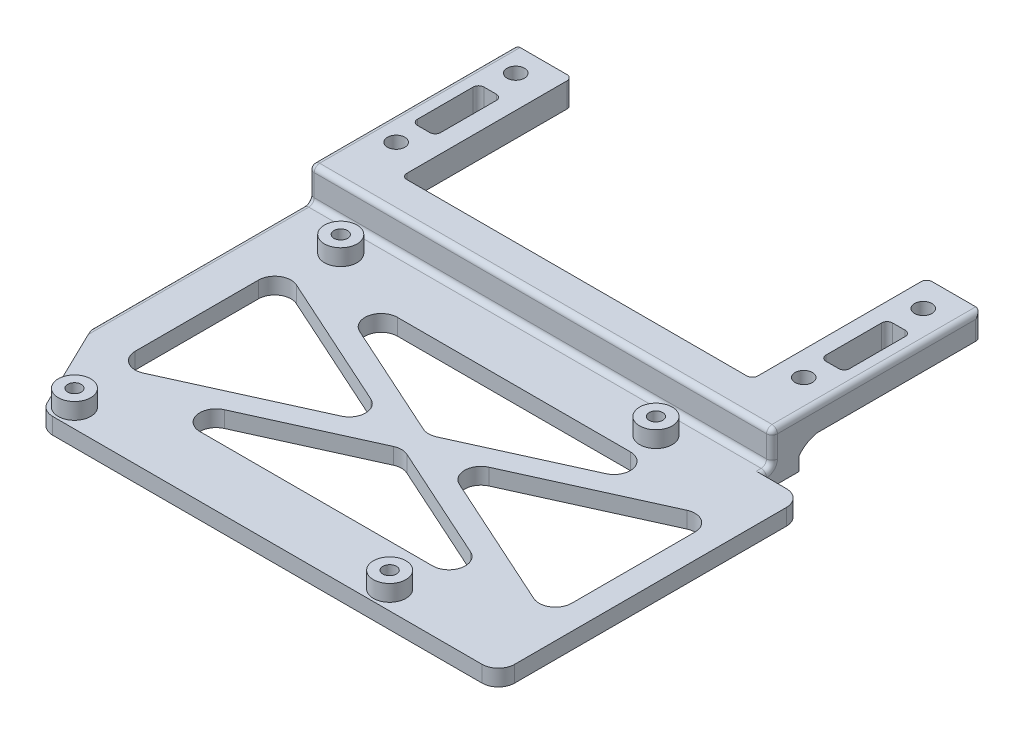
from build123d import *

# Parameters (mm, degrees)
SKETCH1_R           = 1.25
SKETCH1_R_2         = 1.6
BOSS_EXTRUDE1_DEPTH = 3
SKETCH2_W           = 13.728592923
SKETCH2_H           = 41.891364037
CUT_EXTRUDE1_DEPTH  = 3
SKETCH3_W           = 10.623930571
SKETCH3_H           = 41.891364037
SKETCH3_R           = 1.6
SKETCH3_W_2         = 10.036107103
SKETCH3_H_2         = 42.491364037
BOSS_EXTRUDE2_DEPTH = 6
SKETCH4_W           = 41.491364037
SKETCH4_H           = 4.5
CUT_EXTRUDE2_DEPTH  = 115
SKETCH6_W           = 64.582782425
SKETCH6_H           = 2.414533823
BOSS_EXTRUDE3_DEPTH = 4.5
SKETCH7_W           = 80.326682628
SKETCH7_H           = 36.376260707
CUT_EXTRUDE3_DEPTH  = 115
EXTRUDE_THIN1_DEPTH = 3
FILLET2_R           = 3
FILLET3_R           = 1
SKETCH10_R          = 3
SKETCH10_R_2        = 1.25
BOSS_EXTRUDE4_DEPTH = 3
FILLET4_R           = 5
SKETCH13_W          = 85.242820099
SKETCH13_H          = 8
CUT_EXTRUDE5_DEPTH  = 12
SKETCH14_W          = 4.268681069
SKETCH14_H          = 12.243871332
SKETCH14_W_2        = 4.340282215
CUT_EXTRUDE6_DEPTH  = 12
FILLET5_R           = 1
FILLET6_R           = 1


with BuildPart() as part:
    # Sketch1 → Boss-Extrude1 (new body)
    # profile 1 of 4: a face of its own
    with BuildSketch(Plane(origin=(0, 0, 0), x_dir=(1, 0, 0), z_dir=(0, 1, 0))):
        with BuildLine():
            Line((-3.5, 0.5), (-3.5, -34.098087325))
            Line((-3.5, -34.098087325), (73.95, -34.098087325))
            Line((73.95, -34.098087325), (73.95, 3.5))
            Line((73.95, 3.5), (-0.5, 3.5))
            ThreePointArc((-0.5, 3.5), (-2.621320344, 2.621320344), (-3.5, 0.5))
        make_face()
        with Locations(Location((0, 0, 0), (0, 0, 270))):
            Circle(SKETCH1_R, mode=Mode.SUBTRACT)
        with Locations(Location((58, 0, 0), (0, 0, 270))):
            Circle(SKETCH1_R, mode=Mode.SUBTRACT)
    # profile 2 of 4: a face of its own
    with BuildSketch(Plane(origin=(0, 0, 0), x_dir=(1, 0, 0), z_dir=(0, 1, 0))):
        with BuildLine():
            Line((73.95, -34.098087325), (-3.5, -34.098087325))
            Line((-3.5, -34.098087325), (-3.5, -49.5))
            ThreePointArc((-3.5, -49.5), (-3.424038303, -50.170820393), (-3.2, -50.807669683))
            ThreePointArc((-3.2, -50.807669683), (-2.093265664, -52.041948962), (-0.5, -52.5))
            Line((-0.5, -52.5), (78.5, -52.5))
            ThreePointArc((78.5, -52.5), (80.621320344, -51.621320344), (81.5, -49.5))
            Line((81.5, -49.5), (81.5, 0.5))
            ThreePointArc((81.5, 0.5), (80.621320344, 2.621320344), (78.5, 3.5))
            Line((78.5, 3.5), (73.95, 3.5))
            Line((73.95, 3.5), (73.95, -34.098087325))
        make_face()
        with Locations(Location((0, -49, 0), (0, 0, 270))):
            Circle(SKETCH1_R, mode=Mode.SUBTRACT)
        with Locations(Location((58, -49, 0), (0, 0, 270))):
            Circle(SKETCH1_R, mode=Mode.SUBTRACT)
    # profile 3 of 4: a face of its own
    with BuildSketch(Plane(origin=(0, 0, 0), x_dir=(1, 0, 0), z_dir=(0, 1, 0))):
        with BuildLine():
            Line((-3.5, -34.098087325), (-11.292820099, -34.098087325))
            Line((-11.292820099, -34.098087325), (-3.2, -50.807669683))
            ThreePointArc((-3.2, -50.807669683), (-3.424038303, -50.170820393), (-3.5, -49.5))
            Line((-3.5, -49.5), (-3.5, -34.098087325))
        make_face()
    # profile 4 of 4: a face of its own
    with BuildSketch(Plane(origin=(0, 0, 0), x_dir=(1, 0, 0), z_dir=(0, 1, 0))):
        with BuildLine():
            Line((-11.292820099, 51.3), (-11.292820099, -34.098087325))
            Line((-11.292820099, -34.098087325), (-3.5, -34.098087325))
            Line((-3.5, -34.098087325), (-3.5, 0.5))
            ThreePointArc((-3.5, 0.5), (-2.621320344, 2.621320344), (-0.5, 3.5))
            Line((-0.5, 3.5), (73.95, 3.5))
            Line((73.95, 3.5), (73.95, 51.9))
            Line((73.95, 51.9), (63.913892897, 51.9))
            Line((63.913892897, 51.9), (63.913892897, 9.408635963))
            Line((63.913892897, 9.408635963), (13.059703395, 9.408635963))
            Line((13.059703395, 9.408635963), (13.059703395, 51.3))
            Line((13.059703395, 51.3), (-11.292820099, 51.3))
        make_face()
        with Locations(Location((-6.599999997, 24.800000181, 0), (0, 0, 270))):
            Circle(SKETCH1_R_2, mode=Mode.SUBTRACT)
        with Locations(Location((-6.599999997, 46.8, 0), (0, 0, 270))):
            Circle(SKETCH1_R_2, mode=Mode.SUBTRACT)
        with Locations(Location((68.4, 24.800000181, 0), (0, 0, 270))):
            Circle(SKETCH1_R_2, mode=Mode.SUBTRACT)
        with Locations(Location((68.4, 46.8, 0), (0, 0, 270))):
            Circle(SKETCH1_R_2, mode=Mode.SUBTRACT)
    extrude(amount=BOSS_EXTRUDE1_DEPTH)

    # Sketch2 → Cut-Extrude1 (cut)
    with BuildSketch(Plane(origin=(0, 3, 0), x_dir=(1, 0, 0), z_dir=(0, 1, 0))):
        with Locations((6.195406934, 30.354317982)):
            Rectangle(SKETCH2_W, SKETCH2_H)
    extrude(amount=-CUT_EXTRUDE1_DEPTH, mode=Mode.SUBTRACT)

    # Sketch3 → Boss-Extrude2 (add)
    # profile 1 of 3: a face of its own
    with BuildSketch(Plane(origin=(0, 3, 0), x_dir=(1, 0, 0), z_dir=(0, 1, 0))):
        Polygon((-11.292820099, 9.408635963), (-11.292820099, 5.408635963), (73.95, 5.408635963), (73.95, 9.408635963), (63.913892897, 9.408635963), (-0.668889528, 9.408635963), align=None)
    # profile 2 of 3: a face of its own
    with BuildSketch(Plane(origin=(0, 3, 0), x_dir=(1, 0, 0), z_dir=(0, 1, 0))):
        with Locations((-5.980854813, 30.354317982)):
            Rectangle(SKETCH3_W, SKETCH3_H)
        with Locations(Location((-6.599999997, 24.800000181, 0), (0, 0, 270))):
            Circle(SKETCH3_R, mode=Mode.SUBTRACT)
        with Locations(Location((-6.599999997, 46.8, 0), (0, 0, 270))):
            Circle(SKETCH3_R, mode=Mode.SUBTRACT)
    # profile 3 of 3: a face of its own
    with BuildSketch(Plane(origin=(0, 3, 0), x_dir=(1, 0, 0), z_dir=(0, 1, 0))):
        with Locations((68.931946448, 30.654317982)):
            Rectangle(SKETCH3_W_2, SKETCH3_H_2)
        with Locations(Location((68.4, 24.800000181, 0), (0, 0, 270))):
            Circle(SKETCH3_R, mode=Mode.SUBTRACT)
        with Locations(Location((68.4, 46.8, 0), (0, 0, 270))):
            Circle(SKETCH3_R, mode=Mode.SUBTRACT)
    extrude(amount=BOSS_EXTRUDE2_DEPTH)

    # Sketch4 → Cut-Extrude2 (cut)
    with BuildSketch(Plane(origin=(73.95, 0, 0), x_dir=(0, 0, -1), z_dir=(1, 0, 0))):
        with Locations((31.154317982, 2.25)):
            Rectangle(SKETCH4_W, SKETCH4_H)
    extrude(amount=-CUT_EXTRUDE2_DEPTH, mode=Mode.SUBTRACT)

    # Sketch6 → Boss-Extrude3 (add)
    with BuildSketch(Plane(origin=(0, 9, 0), x_dir=(1, 0, 0), z_dir=(0, 1, 0))):
        with Locations((31.622501685, 10.615902875)):
            Rectangle(SKETCH6_W, SKETCH6_H)
    extrude(amount=-BOSS_EXTRUDE3_DEPTH)

    # Sketch7 → Cut-Extrude3 (cut)
    with BuildSketch(Plane(origin=(0, 3, 0), x_dir=(1, 0, 0), z_dir=(0, 1, 0))):
        with Locations((36.856097488, -23.178739559)):
            Rectangle(SKETCH7_W, SKETCH7_H)
    extrude(amount=-CUT_EXTRUDE3_DEPTH, mode=Mode.SUBTRACT)

    # Sketch9 → Extrude-Thin1 (add)
    with BuildSketch(Plane(origin=(0, 3, 0), x_dir=(1, 0, 0), z_dir=(0, 1, 0))):
        Polygon((-4.132294954, -6.812501253), (76.194387674, -43.188761961), (77.844489931, -39.544977864), (-2.482192698, -3.168717156), align=None)
        Polygon((76.194387674, -3.168717156), (-4.132294954, -39.544977864), (-2.482192698, -43.188761961), (77.844489931, -6.812501253), align=None)
    extrude(amount=-EXTRUDE_THIN1_DEPTH)

    # Fillet2
    fillet2_edges = [part.edges().sort_by_distance(p)[0] for p in [
        (1.540940563, 1.5, 41.366869912),
        (72.171254414, 1.5, 41.366869912),
        (77.019438802, 1.5, 7.186128969),
        (77.019438802, 1.5, 39.171350148),
        (72.171254414, 1.5, 4.990609205),
        (1.540940563, 1.5, 4.990609205),
        (-3.307243826, 1.5, 39.171350148),
        (-3.307243826, 1.5, 7.186128969),
        (32.007913099, 1.5, 23.178739558),
        (36.856097488, 1.5, 20.983219794),
        (41.704281877, 1.5, 23.178739558),
        (36.856097488, 1.5, 25.374259322),
    ]]
    fillet(fillet2_edges, radius=FILLET2_R)

    # Fillet3
    fillet3_edges = [part.edges().sort_by_distance(p)[0] for p in [
        (-11.292820099, 3, 14.344725681),
        (73.95, 3, -4.454317982),
        (31.328589951, 3, -5.408635963),
        (-11.292820099, 6, -5.408635963),
        (73.95, 6, -5.408635963),
        (31.328589951, 9, -5.408635963),
    ]]
    fillet(fillet3_edges, radius=FILLET3_R)

    # Sketch10 → Boss-Extrude4 (add)
    # profile 1 of 4: a face of its own
    with BuildSketch(Plane(origin=(0, 3, 0), x_dir=(1, 0, 0), z_dir=(0, 1, 0))):
        with Locations(Location((0, 0, 0), (0, 0, 270))):
            Circle(SKETCH10_R)
        with Locations(Location((0, 0, 0), (0, 0, 270))):
            Circle(SKETCH10_R_2, mode=Mode.SUBTRACT)
    # profile 2 of 4: a face of its own
    with BuildSketch(Plane(origin=(0, 3, 0), x_dir=(1, 0, 0), z_dir=(0, 1, 0))):
        with Locations(Location((58, 0, 0), (0, 0, 270))):
            Circle(SKETCH10_R)
        with Locations(Location((58, 0, 0), (0, 0, 270))):
            Circle(SKETCH10_R_2, mode=Mode.SUBTRACT)
    # profile 3 of 4: a face of its own
    with BuildSketch(Plane(origin=(0, 3, 0), x_dir=(1, 0, 0), z_dir=(0, 1, 0))):
        with Locations(Location((0, -49, 0), (0, 0, 270))):
            Circle(SKETCH10_R)
        with Locations(Location((0, -49, 0), (0, 0, 270))):
            Circle(SKETCH10_R_2, mode=Mode.SUBTRACT)
    # profile 4 of 4: a face of its own
    with BuildSketch(Plane(origin=(0, 3, 0), x_dir=(1, 0, 0), z_dir=(0, 1, 0))):
        with Locations(Location((58, -49, 0), (0, 0, 270))):
            Circle(SKETCH10_R)
        with Locations(Location((58, -49, 0), (0, 0, 270))):
            Circle(SKETCH10_R_2, mode=Mode.SUBTRACT)
    extrude(amount=BOSS_EXTRUDE4_DEPTH)

    # Fillet4
    # the kernel refuses this fillet: 5 mm, written as the material it adds along each edge
    with BuildSketch(Plane(origin=(-13.106232491, 4.5, -9.408635963), x_dir=(0, -1, 0), z_dir=(1, 0, 0))) as fillet4_piece_1_section:
        with BuildLine():
            CenterArc((5, 4.974937186), FILLET4_R, 180, 84.260829523)
            Line((0, 4.974937186), (-0.1, 4.974937186))
            Line((-0.1, 4.974937186), (-0.1, 0))
            Line((-0.1, 0), (0, -0.1))
            ThreePointArc((0, -0.1), (2.25, -0.1), (4.49, -0.099498744))
            Line((4.49, -0.099498744), (4.5, 0))
        make_face()
    fillet4_piece_1 = extrude(amount=77.020125389, mode=Mode.PRIVATE)
    fillet4_piece_1 = split(fillet4_piece_1, bisect_by=Plane(origin=(-11.292820099, 3.269864205, -10.220188755), z_dir=(1, 0, 0)), keep=Keep.TOP, mode=Mode.PRIVATE)
    fillet4_piece_1 = split(fillet4_piece_1, bisect_by=Plane(origin=(-0.668889528, 3.269864205, -10.220188755), z_dir=(-1, 0, 0)), keep=Keep.TOP, mode=Mode.PRIVATE)
    fillet4_piece_1 = split(fillet4_piece_1, bisect_by=Plane(origin=(-5.980854813, 3.269864205, -11.823169786), z_dir=(0, 0, 1)), keep=Keep.TOP, mode=Mode.PRIVATE)
    add(fillet4_piece_1)
    with BuildSketch(Plane(origin=(-13.106232491, 4.5, -9.408635963), x_dir=(0, -1, 0), z_dir=(1, 0, 0))) as fillet4_piece_2_section:
        with BuildLine():
            CenterArc((5, 4.974937186), FILLET4_R, 180, 84.260829523)
            Line((0, 4.974937186), (-0.1, 4.974937186))
            Line((-0.1, 4.974937186), (-0.1, 0))
            Line((-0.1, 0), (0, -0.1))
            ThreePointArc((0, -0.1), (2.25, -0.1), (4.49, -0.099498744))
            Line((4.49, -0.099498744), (4.5, 0))
        make_face()
    fillet4_piece_2 = extrude(amount=77.020125389, mode=Mode.PRIVATE)
    fillet4_piece_2 = split(fillet4_piece_2, bisect_by=Plane(origin=(-11.292820099, 4.370116739, -12.651876795), z_dir=(1, 0, 0)), keep=Keep.TOP, mode=Mode.PRIVATE)
    fillet4_piece_2 = split(fillet4_piece_2, bisect_by=Plane(origin=(-0.668889528, 4.370116739, -12.651876795), z_dir=(-1, 0, 0)), keep=Keep.TOP, mode=Mode.PRIVATE)
    fillet4_piece_2 = split(fillet4_piece_2, bisect_by=Plane(origin=(-5.980854813, 4.370116739, -11.823169786), z_dir=(0, 0, -1)), keep=Keep.TOP, mode=Mode.PRIVATE)
    add(fillet4_piece_2)
    with BuildSketch(Plane(origin=(-0.668889528, 4.5, -9.408635963), x_dir=(0, -1, 0), z_dir=(1, 0, 0))) as fillet4_piece_3_section:
        with BuildLine():
            CenterArc((5, 4.974937186), FILLET4_R, 180, 84.260829523)
            Line((0, 4.974937186), (-0.1, 4.974937186))
            Line((-0.1, 4.974937186), (-0.1, 0))
            Line((-0.1, 0), (0, -0.1))
            ThreePointArc((0, -0.1), (2.25, -0.1), (4.49, -0.099498744))
            Line((4.49, -0.099498744), (4.5, 0))
        make_face()
    fillet4_piece_3 = extrude(amount=64.582782425, mode=Mode.PRIVATE)
    fillet4_piece_3 = split(fillet4_piece_3, bisect_by=Plane(origin=(31.622501685, 3.269864205, -11.823169786), z_dir=(0, 0, 1)), keep=Keep.TOP, mode=Mode.PRIVATE)
    add(fillet4_piece_3)
    with BuildSketch(Plane(origin=(-0.668889528, 4.5, -9.408635963), x_dir=(0, -1, 0), z_dir=(1, 0, 0))) as fillet4_piece_4_section:
        with BuildLine():
            CenterArc((5, 4.974937186), FILLET4_R, 180, 84.260829523)
            Line((0, 4.974937186), (-0.1, 4.974937186))
            Line((-0.1, 4.974937186), (-0.1, 0))
            Line((-0.1, 0), (0, -0.1))
            ThreePointArc((0, -0.1), (2.25, -0.1), (4.49, -0.099498744))
            Line((4.49, -0.099498744), (4.5, 0))
        make_face()
    fillet4_piece_4 = extrude(amount=77.020125389, mode=Mode.PRIVATE)
    fillet4_piece_4 = split(fillet4_piece_4, bisect_by=Plane(origin=(68.931946449, 3.269864205, -11.823169786), z_dir=(0, 0, 1)), keep=Keep.TOP, mode=Mode.PRIVATE)
    fillet4_piece_4 = split(fillet4_piece_4, bisect_by=Plane(origin=(63.913892897, 3.269864205, -10.220188755), z_dir=(1, 0, 0)), keep=Keep.TOP, mode=Mode.PRIVATE)
    fillet4_piece_4 = split(fillet4_piece_4, bisect_by=Plane(origin=(73.95, 3.269864205, -10.220188755), z_dir=(-1, 0, 0)), keep=Keep.TOP, mode=Mode.PRIVATE)
    add(fillet4_piece_4)
    with BuildSketch(Plane(origin=(-0.668889528, 4.5, -9.408635963), x_dir=(0, -1, 0), z_dir=(1, 0, 0))) as fillet4_piece_5_section:
        with BuildLine():
            CenterArc((5, 4.974937186), FILLET4_R, 180, 84.260829523)
            Line((0, 4.974937186), (-0.1, 4.974937186))
            Line((-0.1, 4.974937186), (-0.1, 0))
            Line((-0.1, 0), (0, -0.1))
            ThreePointArc((0, -0.1), (2.25, -0.1), (4.49, -0.099498744))
            Line((4.49, -0.099498744), (4.5, 0))
        make_face()
    fillet4_piece_5 = extrude(amount=77.020125389, mode=Mode.PRIVATE)
    fillet4_piece_5 = split(fillet4_piece_5, bisect_by=Plane(origin=(68.931946449, 4.370116739, -11.823169786), z_dir=(0, 0, -1)), keep=Keep.TOP, mode=Mode.PRIVATE)
    fillet4_piece_5 = split(fillet4_piece_5, bisect_by=Plane(origin=(63.913892897, 4.370116739, -12.651876795), z_dir=(1, 0, 0)), keep=Keep.TOP, mode=Mode.PRIVATE)
    fillet4_piece_5 = split(fillet4_piece_5, bisect_by=Plane(origin=(73.95, 4.370116739, -12.651876795), z_dir=(-1, 0, 0)), keep=Keep.TOP, mode=Mode.PRIVATE)
    add(fillet4_piece_5)

    # Sketch13 → Cut-Extrude5 (cut)
    with BuildSketch(Plane(origin=(0, 9, 0), x_dir=(1, 0, 0), z_dir=(0, 1, 0))):
        with Locations((31.328589951, 17.494955059)):
            Rectangle(SKETCH13_W, SKETCH13_H)
    extrude(amount=-CUT_EXTRUDE5_DEPTH, mode=Mode.SUBTRACT)


with BuildPart() as cut_extrude5_piece_1:
    # of the separate pieces the step leaves, piece 1, a body of its own (cut_extrude5_pieces)
    add(part.part.solids().sort_by_distance((73.95, 4.420402208, -13.494955059))[0])


with BuildPart() as cut_extrude5_piece_2:
    # of the separate pieces the step leaves, piece 2, a body of its own (cut_extrude5_pieces)
    add(part.part.solids().sort_by_distance((-0.668889528, 4.5, -51.3))[0])


with BuildPart() as cut_extrude5_piece_3:
    # of the separate pieces the step leaves, piece 3, a body of its own (cut_extrude5_pieces)
    add(part.part.solids().sort_by_distance((73.95, 4.5, -21.494955059))[0])


with BuildPart() as cut_extrude5_piece_2_1:
    # Body-Move/Copy1: moved
    add(cut_extrude5_piece_2.part.moved(Location((0, 0, 8))))


with BuildPart() as cut_extrude5_piece_3_1:
    # Body-Move/Copy1: moved
    add(cut_extrude5_piece_3.part.moved(Location((0, 0, 8))))


with BuildPart() as cut_extrude5_piece_2_2:
    add(cut_extrude5_piece_2_1.part)

    # Combine1: union Cut-Extrude5 piece 3, Cut-Extrude5 piece 1
    add(cut_extrude5_piece_3_1.part)
    add(cut_extrude5_piece_1.part)

    # Sketch14 → Cut-Extrude6 (cut)
    with BuildSketch(Plane(origin=(0, 9, 0), x_dir=(1, 0, 0), z_dir=(0, 1, 0))):
        with Locations((-6.180496231, 27.553845348)):
            Rectangle(SKETCH14_W, SKETCH14_H)
        with Locations((69.0290644, 27.553845348)):
            Rectangle(SKETCH14_W_2, SKETCH14_H)
    extrude(amount=-CUT_EXTRUDE6_DEPTH, mode=Mode.SUBTRACT)

    # Fillet5
    fillet5_edges = [cut_extrude5_piece_2_2.edges().sort_by_distance(p)[0] for p in [
        (-8.314836765, 6.75, -21.431909682),
        (-8.314836765, 6.75, -33.675781014),
        (-4.046155696, 6.75, -33.675781014),
        (-4.046155696, 6.75, -21.431909682),
        (66.858923292, 6.75, -21.431909682),
        (66.858923292, 6.75, -33.675781014),
        (71.199205507, 6.75, -33.675781014),
        (71.199205507, 6.75, -21.431909682),
    ]]
    fillet(fillet5_edges, radius=FILLET5_R)

    # Fillet6
    # the kernel refuses this fillet: 1 mm, written as the material it adds along each edge
    with BuildSketch(Plane(origin=(63.913892897, 1.29468679, -11.823169786), x_dir=(-1, 0, 0), z_dir=(0, 1, 0))) as fillet6_piece_1_section:
        with BuildLine():
            CenterArc((FILLET6_R, -FILLET6_R), FILLET6_R, 90, 90)
            Line((0, -FILLET6_R), (0, 0))
            Line((0, 0), (FILLET6_R, 0))
        make_face()
    fillet6_piece_1 = extrude(amount=7.70531321, mode=Mode.PRIVATE)
    fillet6_piece_1 = fillet6_piece_1 - Plane(origin=(63.684743163, -0.5, -14.383573149), x_dir=(0, -1, 0), z_dir=(-1, 0, 0)) * Cylinder(5, 20, mode=Mode.PRIVATE)
    add(fillet6_piece_1)
    with BuildSketch(Plane(origin=(-0.668889528, 1.29468679, -11.823169786), x_dir=(0, 0, -1), z_dir=(0, 1, 0))) as fillet6_piece_2_section:
        with BuildLine():
            CenterArc((FILLET6_R, -FILLET6_R), FILLET6_R, 90, 90)
            Line((0, -FILLET6_R), (0, 0))
            Line((0, 0), (FILLET6_R, 0))
        make_face()
    fillet6_piece_2 = extrude(amount=7.70531321, mode=Mode.PRIVATE)
    fillet6_piece_2 = fillet6_piece_2 - Plane(origin=(-0.439739678, -0.5, -14.383573149), x_dir=(0, -1, 0), z_dir=(-1, 0, 0)) * Cylinder(5, 20, mode=Mode.PRIVATE)
    add(fillet6_piece_2)
    # the kernel refuses this fillet: 1 mm, written as the material it takes off along each edge
    with BuildSketch(Plane(origin=(-10.292820099, 8, -6.408635963), x_dir=(0, 1, 0), z_dir=(-1, 0, 0))) as fillet6_2_piece_1_section:
        Polygon((0, 0), (FILLET6_R, 0), (FILLET6_R, -FILLET6_R), (0, -FILLET6_R), align=None)
    fillet6_2_piece_1 = extrude(amount=FILLET6_R, mode=Mode.PRIVATE)
    fillet6_2_piece_1 = fillet6_2_piece_1 - Plane(origin=(-10.292820099, 8, -6.408635963), x_dir=(0, -0.7071067811865475, -0.7071067811865475), z_dir=(-1, 0, 0)) * Sphere(FILLET6_R, mode=Mode.PRIVATE)
    add(fillet6_2_piece_1, mode=Mode.SUBTRACT)
    with BuildSketch(Plane(origin=(72.95, 8, -6.408635963), x_dir=(1, 0, 0), z_dir=(0, 1, 0))) as fillet6_2_piece_2_section:
        Polygon((0, 0), (FILLET6_R, 0), (FILLET6_R, -FILLET6_R), (0, -FILLET6_R), align=None)
    fillet6_2_piece_2 = extrude(amount=FILLET6_R, mode=Mode.PRIVATE)
    fillet6_2_piece_2 = fillet6_2_piece_2 - Plane(origin=(72.95, 8, -6.408635963), x_dir=(-0.7071067811865475, 0, -0.7071067811865475), z_dir=(0, 1, 0)) * Sphere(FILLET6_R, mode=Mode.PRIVATE)
    add(fillet6_2_piece_2, mode=Mode.SUBTRACT)
    with BuildSketch(Plane(origin=(-11.292820099, 9, -45.8), x_dir=(0, -1, 0), z_dir=(0, 0, 1))) as fillet6_2_piece_3:
        with BuildLine():
            CenterArc((FILLET6_R, FILLET6_R), FILLET6_R, 180, 90)
            Line((0, FILLET6_R), (0, 0))
            Line((0, 0), (FILLET6_R, 0))
        make_face()
    extrude(amount=39.391364037, mode=Mode.SUBTRACT)
    with BuildSketch(Plane(origin=(73.95, 2, -43.9), x_dir=(0, 0, 1), z_dir=(0, 1, 0)), Plane(origin=(-0.668889528, 2, -43.3), x_dir=(0, 0, 1), z_dir=(0, 1, 0)), Plane(origin=(63.913892897, 2, -43.9), x_dir=(1, 0, 0), z_dir=(0, 1, 0)), Plane(origin=(-11.292820099, 11.5, -43.3), x_dir=(0, 0, 1), z_dir=(0, -1, 0))) as fillet6_2_piece_4:
        with BuildLine():
            CenterArc((FILLET6_R, -FILLET6_R), FILLET6_R, 90, 90)
            Line((0, -FILLET6_R), (0, 0))
            Line((0, 0), (FILLET6_R, 0))
        make_face()
    extrude(amount=9.5, mode=Mode.SUBTRACT)
    with BuildSketch(Plane(origin=(73.95, 9, -46.4), x_dir=(-1, 0, 0), z_dir=(0, 0, 1))) as fillet6_2_piece_5:
        with BuildLine():
            CenterArc((FILLET6_R, FILLET6_R), FILLET6_R, 180, 90)
            Line((0, FILLET6_R), (0, 0))
            Line((0, 0), (FILLET6_R, 0))
        make_face()
    extrude(amount=39.991364037, mode=Mode.SUBTRACT)


solid = cut_extrude5_piece_2_2.part
